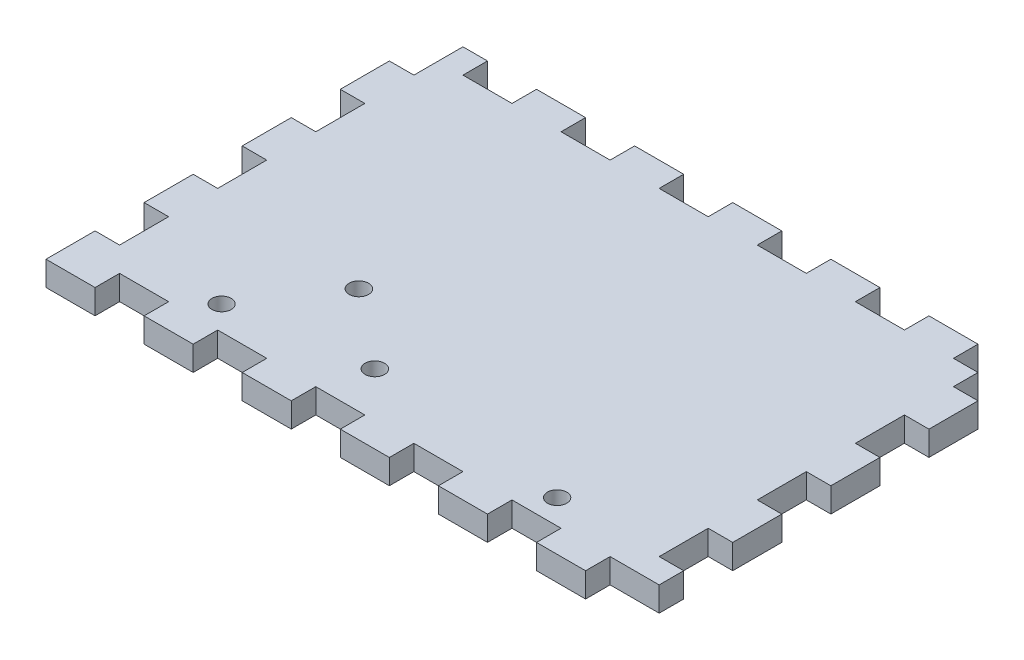
from build123d import *

# Parameters (mm, degrees)
SKETCH1_W             = 152.4
SKETCH1_H             = 101.6
BOSS_EXTRUDE2_DEPTH   = 6.35
SKETCH2_W             = 6.35
SKETCH2_H             = 12.7
CUT_EXTRUDE2_DEPTH    = 6.35
SKETCH2_4_W           = 12.7
SKETCH2_4_H           = 6.35
CUT_EXTRUDE3_DEPTH    = 6.35
F_5_0MM_DOWEL_HOLE4_D = 5
F_5_0MM_DOWEL_HOLE6_D = 5.05


with BuildPart() as part:
    # Sketch1 → Boss-Extrude2 (new body)
    with BuildSketch(Plane(origin=(0, 0, 0), x_dir=(1, 0, 0), z_dir=(0, 1, 0))):
        with Locations((76.2, 50.8)):
            Rectangle(SKETCH1_W, SKETCH1_H)
    extrude(amount=BOSS_EXTRUDE2_DEPTH)

    # Sketch2 → Cut-Extrude2 (cut)
    with BuildSketch(Plane(origin=(0, 6.35, 0), x_dir=(1, 0, 0), z_dir=(0, 1, 0))):
        with Locations((3.175, 95.25)):
            Rectangle(SKETCH2_W, SKETCH2_H)
        with Locations((3.175, 69.85)):
            Rectangle(SKETCH2_W, SKETCH2_H)
        with Locations((3.175, 44.45)):
            Rectangle(SKETCH2_W, SKETCH2_H)
        with Locations((3.175, 19.05)):
            Rectangle(SKETCH2_W, SKETCH2_H)
    cut_extrude2 = extrude(amount=-CUT_EXTRUDE2_DEPTH, mode=Mode.SUBTRACT)

    # Mirror1: Cut-Extrude2 across plane
    add(cut_extrude2.mirror(Plane.ZY.offset(-76.2)), mode=Mode.SUBTRACT)

    # Sketch2<4> → Cut-Extrude3 (cut)
    with BuildSketch(Plane(origin=(0, 6.35, 0), x_dir=(1, 0, 0), z_dir=(0, 1, 0))):
        with Locations((19.05, 98.425)):
            Rectangle(SKETCH2_4_W, SKETCH2_4_H)
        with Locations((44.45, 98.425)):
            Rectangle(SKETCH2_4_W, SKETCH2_4_H)
        with Locations((69.85, 98.425)):
            Rectangle(SKETCH2_4_W, SKETCH2_4_H)
        with Locations((95.25, 98.425)):
            Rectangle(SKETCH2_4_W, SKETCH2_4_H)
        with Locations((146.05, 98.425)):
            Rectangle(SKETCH2_4_W, SKETCH2_4_H)
        with Locations((120.65, 98.425)):
            Rectangle(SKETCH2_4_W, SKETCH2_4_H)
    cut_extrude3 = extrude(amount=-CUT_EXTRUDE3_DEPTH, mode=Mode.SUBTRACT)

    # Mirror2: Cut-Extrude3 across plane
    add(cut_extrude3.mirror(Plane(origin=(0, 0, -50.8), x_dir=(1, 0, 0), z_dir=(0, 0, -1))), mode=Mode.SUBTRACT)

    # Ø5.0mm Dowel Hole4 (through all)
    with Locations(Plane(origin=(0, 0, 0), x_dir=(-1, 0, 0), z_dir=(0, -1, 0))):
        with Locations((-119.634, 12.7), (-32.766, 12.7)):
            Hole(F_5_0MM_DOWEL_HOLE4_D / 2)

    # Ø5.0mm Dowel Hole6 (through all)
    with Locations(Plane(origin=(0, 0, 0), x_dir=(-1, 0, 0), z_dir=(0, -1, 0))):
        with Locations((-67.15, 17.986846397), (-47.15, 33.862677549)):
            Hole(F_5_0MM_DOWEL_HOLE6_D / 2)


solid = part.part
